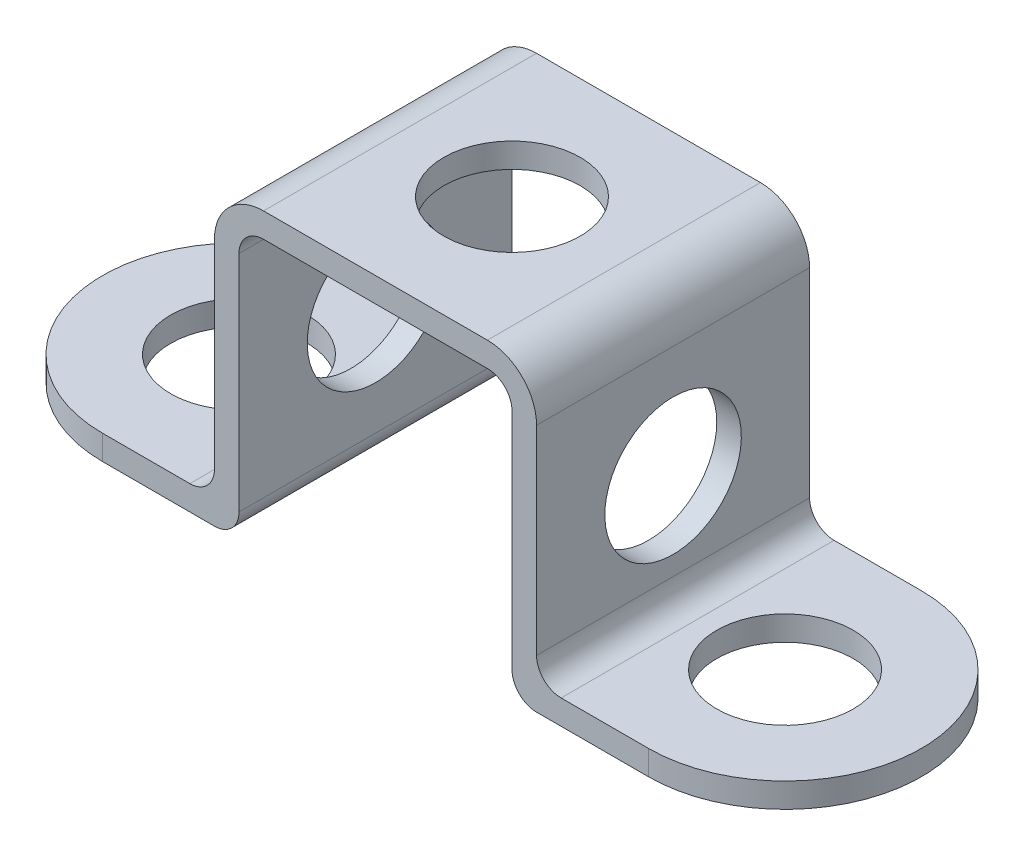
from build123d import *

# Parameters (mm, degrees)
BASE_FLANGE1_DEPTH = 10
FILLET1_R          = 0.9
SKETCH6_R          = 2.5
CUT_EXTRUDE3_DEPTH = 21.615528128
SKETCH7_R          = 2.5
CUT_EXTRUDE4_DEPTH = 22.066798523
SKETCH8_R          = 2.5
CUT_EXTRUDE5_DEPTH = 26.605077621


# Sheet-metal steps are written as plain solids
with BuildPart() as part:
    # Sketch1 → Base-Flange1 (new body)
    with BuildSketch(Plane.XY):
        with BuildLine():
            Line((-4.1, 10), (4.1, 10))
            ThreePointArc((4.1, 10), (4.736396103, 9.736396103), (5, 9.1))
            Line((5, 9.1), (5, 0.9))
            ThreePointArc((5, 0.9), (5.263603897, 0.263603897), (5.9, 0))
            Line((5.9, 0), (15, 0))
            Line((15, 0), (15, 0.9))
            Line((15, 0.9), (5.9, 0.9))
            Line((5.9, 0.9), (5.9, 9.1))
            ThreePointArc((5.9, 9.1), (5.372792206, 10.372792206), (4.1, 10.9))
            Line((4.1, 10.9), (-4.1, 10.9))
            ThreePointArc((-4.1, 10.9), (-5.372792206, 10.372792206), (-5.9, 9.1))
            Line((-5.9, 9.1), (-5.9, 0.9))
            Line((-5.9, 0.9), (-15, 0.9))
            Line((-15, 0.9), (-15, 0))
            Line((-15, 0), (-5.9, 0))
            ThreePointArc((-5.9, 0), (-5.263603897, 0.263603897), (-5, 0.9))
            Line((-5, 0.9), (-5, 9.1))
            ThreePointArc((-5, 9.1), (-4.736396103, 9.736396103), (-4.1, 10))
        make_face()
    extrude(amount=-BASE_FLANGE1_DEPTH)

    # Fillet1
    fillet1_edges = [part.edges().sort_by_distance(p)[0] for p in [
        (-5.9, 0.9, -5),
        (5.9, 0.9, -5),
    ]]
    fillet(fillet1_edges, radius=FILLET1_R)

    # Sketch6 → Cut-Extrude3 (cut, through all)
    with BuildSketch(Plane(origin=(0, 0.9, 0), x_dir=(1, 0, 0), z_dir=(0, 1, 0))):
        with Locations(Location((-10, 5, 0), (0, 0, 180))):
            Circle(SKETCH6_R)
        with BuildLine():
            Line((-15, 10), (-15, 5))
            ThreePointArc((-15, 5), (-13.535533906, 8.535533906), (-10, 10))
            Line((-10, 10), (-15, 10))
        make_face()
        with BuildLine():
            Line((-15, 0), (-10, 0))
            ThreePointArc((-10, 0), (-13.535533906, 1.464466094), (-15, 5))
            Line((-15, 5), (-15, 0))
        make_face()
    cut_extrude3 = extrude(amount=-CUT_EXTRUDE3_DEPTH, mode=Mode.SUBTRACT)

    # Mirror1: Cut-Extrude3 across plane
    add(cut_extrude3.mirror(Plane(origin=(0, 0, 0), x_dir=(0, 0, 1), z_dir=(1, 0, 0))), mode=Mode.SUBTRACT)

    # Sketch7 → Cut-Extrude4 (cut, through all)
    with BuildSketch(Plane(origin=(0, 10.9, 0), x_dir=(1, 0, 0), z_dir=(0, 1, 0))):
        with Locations(Location((0, 5, 0), (0, 0, 180))):
            Circle(SKETCH7_R)
    extrude(amount=-CUT_EXTRUDE4_DEPTH, mode=Mode.SUBTRACT)

    # Sketch8 → Cut-Extrude5 (cut, through all)
    with BuildSketch(Plane(origin=(5.9, 0, 0), x_dir=(0, 0, -1), z_dir=(1, 0, 0))):
        with Locations(Location((5, 5, 0), (0, 0, 90))):
            Circle(SKETCH8_R)
    extrude(amount=-CUT_EXTRUDE5_DEPTH, mode=Mode.SUBTRACT)


solid = part.part
